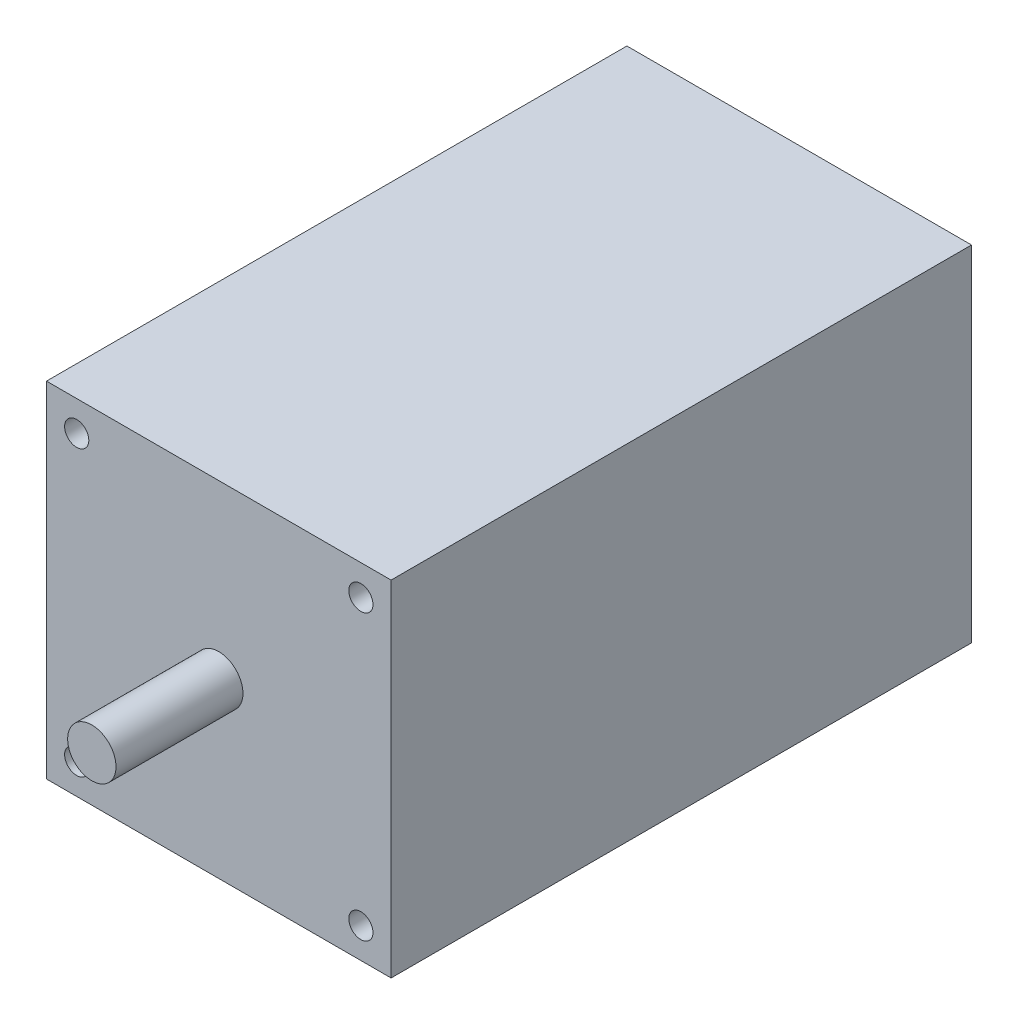
from build123d import *

# Parameters (mm, degrees)
SKETCH_1_W      = 57
SKETCH_1_H      = 57
SKETCH_1_R      = 2
EXTRUDE_1_DEPTH = 96
SKETCH_2_R      = 4
EXTRUDE_2_DEPTH = 21


with BuildPart() as part:
    # 草圖1 → 填料-伸長1 (new body)
    with BuildSketch(Plane.XY):
        Rectangle(SKETCH_1_W, SKETCH_1_H)
        with Locations((-23.5, 23.5)):
            Circle(SKETCH_1_R, mode=Mode.SUBTRACT)
        with Locations((23.5, 23.5)):
            Circle(SKETCH_1_R, mode=Mode.SUBTRACT)
        with Locations((23.5, -23.5)):
            Circle(SKETCH_1_R, mode=Mode.SUBTRACT)
        with Locations((-23.5, -23.5)):
            Circle(SKETCH_1_R, mode=Mode.SUBTRACT)
    extrude(amount=-EXTRUDE_1_DEPTH)

    # 草圖2 → 填料-伸長2 (add)
    with BuildSketch(Plane.XY):
        Circle(SKETCH_2_R)
    extrude(amount=EXTRUDE_2_DEPTH)


solid = part.part
